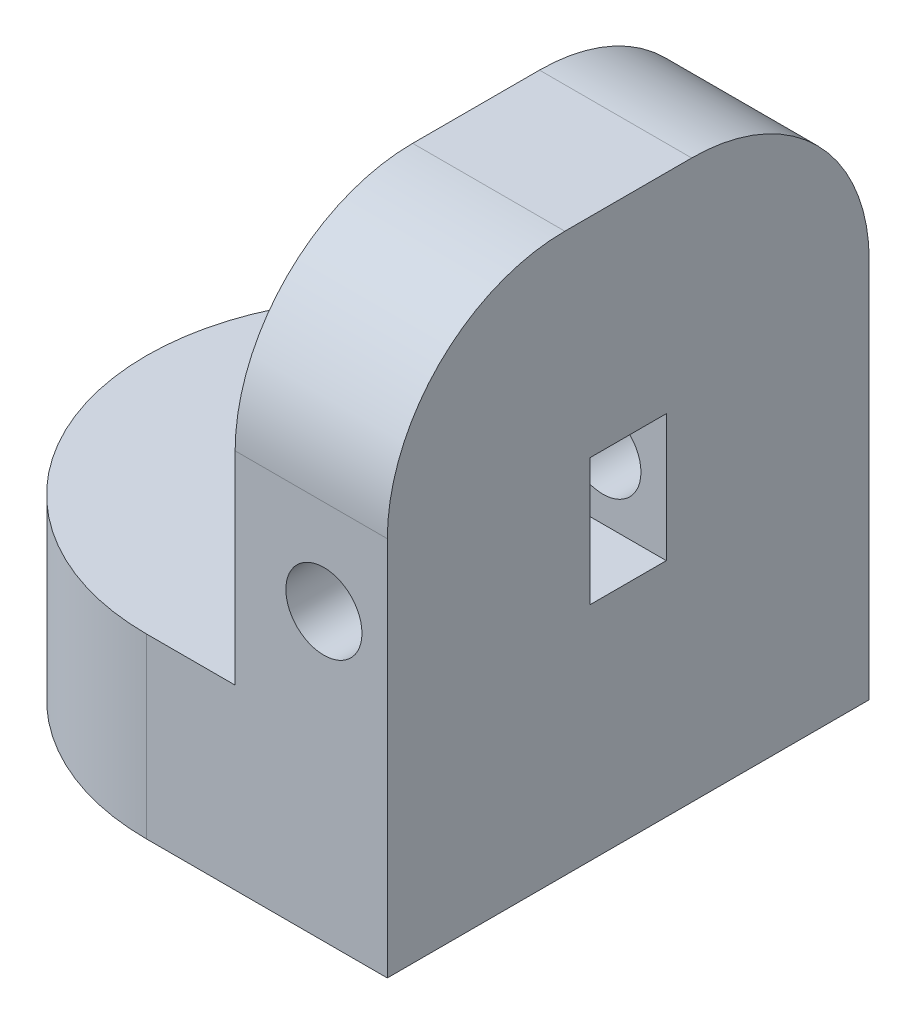
from build123d import *

# Parameters (mm, degrees)
SKETCH1_W               = 19
SKETCH1_H               = 19
BOSS_EXTRUDE1_DEPTH     = 7
FILLET1_R               = 9.5
SKETCH2_W               = 6
SKETCH2_H               = 19
BOSS_EXTRUDE2_DEPTH     = 15
FILLET2_R               = 7
SKETCH3_W               = 3
SKETCH3_H               = 5.02
CUT_EXTRUDE1_DEPTH      = 31.581857367
CUT_EXTRUDE2_DEPTH      = 27.367593747
CUT_EXTRUDE2_DEPTH_BACK = 27.367593747
SKETCH4_R               = 1.5
SKETCH5_R               = 2
CUT_EXTRUDE3_DEPTH      = 21.137030566


with BuildPart() as part:
    # Sketch1 → Boss-Extrude1 (new body)
    with BuildSketch(Plane(origin=(0, 0, 0), x_dir=(1, 0, 0), z_dir=(0, 1, 0))):
        Rectangle(SKETCH1_W, SKETCH1_H)
    extrude(amount=BOSS_EXTRUDE1_DEPTH)

    # Fillet1
    fillet1_edges = [part.edges().sort_by_distance(p)[0] for p in [
        (-9.5, 3.5, -9.5),
        (-9.5, 3.5, 9.5),
    ]]
    fillet(fillet1_edges, radius=FILLET1_R - 0.0001)  # a hair under: the kernel refuses the full size

    # Sketch2 → Boss-Extrude2 (add)
    with BuildSketch(Plane(origin=(0, 7, 0), x_dir=(1, 0, 0), z_dir=(0, 1, 0))):
        with Locations((6.5, 0)):
            Rectangle(SKETCH2_W, SKETCH2_H)
    extrude(amount=BOSS_EXTRUDE2_DEPTH)

    # Fillet2
    fillet2_edges = [part.edges().sort_by_distance(p)[0] for p in [
        (6.5, 22, -9.5),
        (6.5, 22, 9.5),
    ]]
    fillet(fillet2_edges, radius=FILLET2_R)

    # Sketch3 → Cut-Extrude1 (cut, through all)
    with BuildSketch(Plane(origin=(9.5, 0, 0), x_dir=(0, 0, -1), z_dir=(1, 0, 0))):
        with Locations((0, 11.26)):
            Rectangle(SKETCH3_W, SKETCH3_H)
    extrude(amount=-CUT_EXTRUDE1_DEPTH, mode=Mode.SUBTRACT)

    # Sketch4 → Cut-Extrude2 (cut, two sides: drawn at the far end of the back side and taken through both)
    with BuildSketch(Plane.XY.offset(-1.5).offset(-CUT_EXTRUDE2_DEPTH_BACK)):
        with Locations((7, 11.27)):
            Circle(SKETCH4_R)
    extrude(amount=CUT_EXTRUDE2_DEPTH + CUT_EXTRUDE2_DEPTH_BACK, mode=Mode.SUBTRACT)

    # Sketch5 → Cut-Extrude3 (cut, through all)
    with BuildSketch(Plane(origin=(0, 7, 0), x_dir=(1, 0, 0), z_dir=(0, 1, 0))):
        with Locations(Location((-2, 0, 0), (0, 0, 270))):
            Circle(SKETCH5_R)
    extrude(amount=-CUT_EXTRUDE3_DEPTH, mode=Mode.SUBTRACT)


solid = part.part
